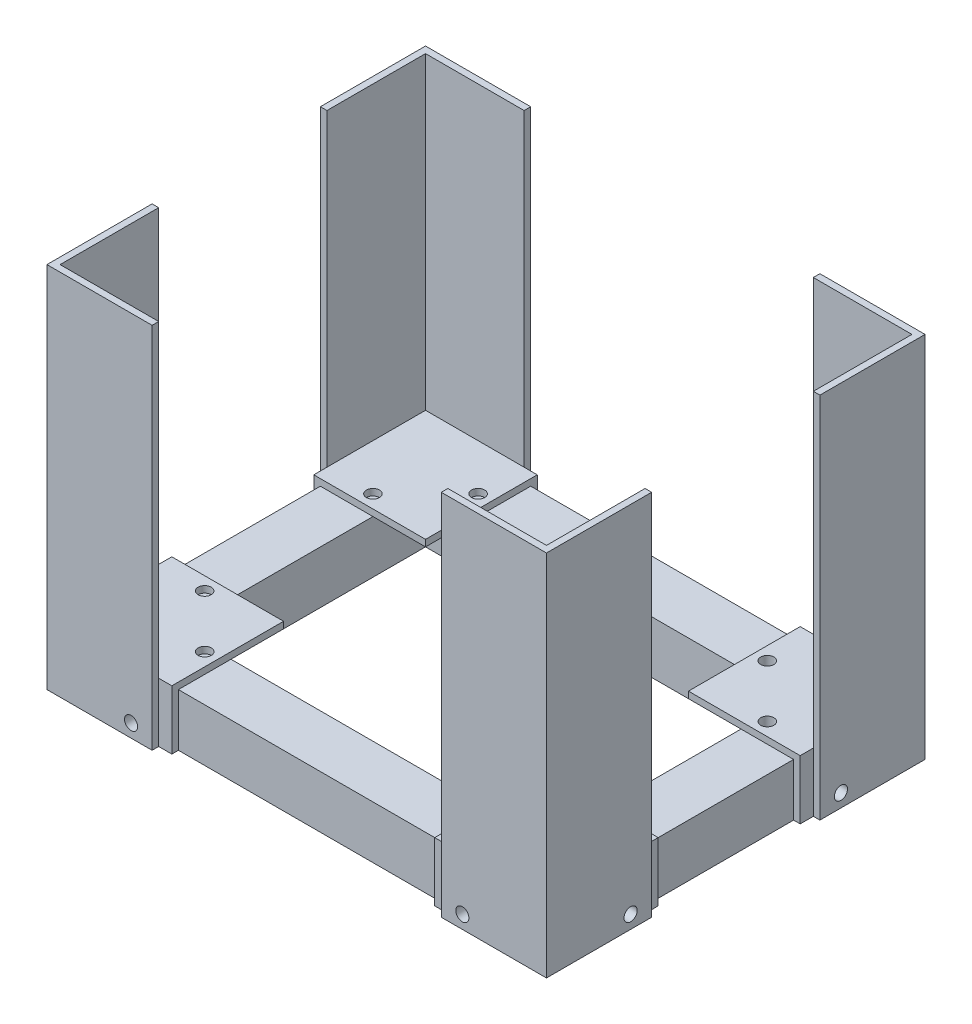
from build123d import *
from build123d.topology import SkipClean

# Parameters (mm, degrees)
SKETCH2_W             = 25.4
SKETCH2_H             = 119.38
BOSS_EXTRUDE1_DEPTH   = 25.4
SKETCH8_W             = 50.8
SKETCH8_H             = 3.175
BOSS_EXTRUDE9_DEPTH   = 25.4
SKETCH11_W            = 53.975
SKETCH11_H            = 53.975
BOSS_EXTRUDE12_DEPTH  = 3.175
CHAMFER3_SIZE         = 5.08
SKETCH10_W            = 3.175
SKETCH10_H            = 47.625
BOSS_EXTRUDE11_DEPTH  = 177.8
SKETCH13_R            = 3.175
CUT_EXTRUDE3_DEPTH    = 31.75
SKETCH14_R            = 3.175
CUT_EXTRUDE4_DEPTH    = 28.575
SKETCH16_R            = 3.175
CUT_EXTRUDE5_DEPTH    = 31.75
MIRROR71_START        = -1
MIRROR71_OUTLINE_R    = 3.175
MIRROR71_DEPTH        = 26.4
MIRROR71_2_DEPTH      = 177.8
MIRROR71_START_2      = 25.4
MIRROR71_3_OUTLINE_R  = 3.175
MIRROR71_3_DEPTH      = 3.175
MIRROR71_START_3      = 9.525
MIRROR71_4_OUTLINE_R  = 3.175
MIRROR71_4_DEPTH      = 15.875
MIRROR71_5_OUTLINE_R  = 3.175
MIRROR71_5_DEPTH      = 3.1749999
MIRROR71_START_4      = 2.6969085
MIRROR71_6_OUTLINE_R  = 3.175
MIRROR71_6_DEPTH      = 17.145
MIRROR71_START_5      = -85.09
MIRROR71_7_OUTLINE_W  = 3.175
MIRROR71_7_OUTLINE_H  = 6.3500001
MIRROR71_7_OUTLINE_R  = 3.175
MIRROR71_7_DEPTH      = 25.4
MIRROR71_START_6      = 59.69
MIRROR71_8_DEPTH      = 28.575
MIRROR71_START_7      = -88.265
MIRROR71_9_DEPTH      = 3.175
MIRROR71_START_8      = 85.09
MIRROR71_10_DEPTH     = 3.175
MIRROR71_START_9      = -91.896565
MIRROR71_11_OUTLINE_W = 6.3500001
MIRROR71_11_OUTLINE_H = 25.4
MIRROR71_11_DEPTH     = 155.396565
MIRROR71_START_10     = 88.9
MIRROR71_12_DEPTH     = 28.575
MIRROR71_START_11     = -114.3
MIRROR71_13_OUTLINE_R = 3.175
MIRROR71_13_DEPTH     = 25.4
MIRROR71_START_12     = 114.3
MIRROR71_14_DEPTH     = 3.175
MIRROR71_START_13     = -92
MIRROR71_15_OUTLINE_R = 3.175
MIRROR71_15_DEPTH     = 184
MIRROR71_16_OUTLINE_R = 3.175
MIRROR71_16_DEPTH     = 33.1


with BuildPart() as part:
    # Sketch2 → Boss-Extrude1 (new body)
    with BuildSketch(Plane(origin=(0, 0, 0), x_dir=(1, 0, 0), z_dir=(0, 1, 0))):
        Polygon((114.3, -59.69), (88.9, -59.69), (-88.9, -59.69), (-114.3, -59.69), (-114.3, -85.09), (114.3, -85.09), align=None)
        with Locations((101.6, 0)):
            Rectangle(SKETCH2_W, SKETCH2_H)
        Polygon((-88.9, 59.69), (88.9, 59.69), (114.3, 59.69), (114.3, 85.09), (-114.3, 85.09), (-114.3, 59.69), align=None)
        with Locations((-101.6, 0)):
            Rectangle(SKETCH2_W, SKETCH2_H)
    boss_extrude1 = extrude(amount=BOSS_EXTRUDE1_DEPTH)

    # Sketch8 → Boss-Extrude9 (add)
    with BuildSketch(Plane(origin=(0, 25.4, 0), x_dir=(1, 0, 0), z_dir=(0, 1, 0))):
        with Locations((-88.9, -86.6775)):
            Rectangle(SKETCH8_W, SKETCH8_H)
        Polygon((-114.3, -88.265), (-114.3, -85.09), (-114.3, -34.29), (-117.475, -34.29), (-117.475, -88.265), align=None)
    boss_extrude9 = extrude(amount=-BOSS_EXTRUDE9_DEPTH)

    # Sketch11 → Boss-Extrude12 (add)
    with BuildSketch(Plane(origin=(0, 25.4, 0), x_dir=(1, 0, 0), z_dir=(0, 1, 0))):
        with Locations((-90.4875, -61.2775)):
            Rectangle(SKETCH11_W, SKETCH11_H)
    boss_extrude12 = extrude(amount=BOSS_EXTRUDE12_DEPTH)

    # Chamfer3
    chamfer3_edges = [part.edges().sort_by_distance(p)[0] for p in [
        (-117.475, 14.2875, 88.265),
    ]]
    chamfer(chamfer3_edges, length=CHAMFER3_SIZE)

    # Sketch10 → Boss-Extrude11 (add)
    with BuildSketch(Plane(origin=(0, 0, 0), x_dir=(-1, 0, 0), z_dir=(0, -1, 0))):
        with Locations((119.0625, -64.4525)):
            Rectangle(SKETCH10_W, SKETCH10_H)
        Polygon((120.65, -88.265), (117.475, -88.265), (69.85, -88.265), (69.85, -91.44), (120.65, -91.44), align=None)
    boss_extrude11 = extrude(amount=-BOSS_EXTRUDE11_DEPTH)

    # Sketch13 → Cut-Extrude3 (cut)
    with BuildSketch(Plane.XY.offset(91.44)):
        with Locations((-80.01, 6.35)):
            Circle(SKETCH13_R)
    cut_extrude3 = extrude(amount=-CUT_EXTRUDE3_DEPTH, mode=Mode.SUBTRACT)

    # Sketch14 → Cut-Extrude4 (cut)
    with BuildSketch(Plane(origin=(0, 28.575, 0), x_dir=(1, 0, 0), z_dir=(0, 1, 0))):
        with Locations(Location((-69.85, -66.04, 0), (0, 0, 270))):
            Circle(SKETCH14_R)
        with Locations(Location((-95.25, -40.64, 0), (0, 0, 270))):
            Circle(SKETCH14_R)
    cut_extrude4 = extrude(amount=-CUT_EXTRUDE4_DEPTH, mode=Mode.SUBTRACT)

    # Sketch16 → Cut-Extrude5 (cut)
    with BuildSketch(Plane.ZY.offset(120.65)):
        with Locations((50.8, 6.35)):
            Circle(SKETCH16_R)
    cut_extrude5 = extrude(amount=-CUT_EXTRUDE5_DEPTH, mode=Mode.SUBTRACT)

    # Mirror70: Boss-Extrude1, Boss-Extrude9, Boss-Extrude12, Boss-Extrude11, Cut-Extrude3, Cut-Extrude4, Cut-Extrude5 across plane
    add(boss_extrude1.mirror(Plane.XY))
    add(boss_extrude9.mirror(Plane.XY))
    add(boss_extrude12.mirror(Plane.XY))
    add(boss_extrude11.mirror(Plane.XY))
    add(cut_extrude3.mirror(Plane.XY), mode=Mode.SUBTRACT)
    add(cut_extrude4.mirror(Plane.XY), mode=Mode.SUBTRACT)
    add(cut_extrude5.mirror(Plane.XY), mode=Mode.SUBTRACT)

    # Mirror71: read off the stored shape, not the designer's step
    # Mirror71 outline → Mirror71 (cut)
    with BuildSketch(Plane(origin=(0, 0, 0), x_dir=(1, 0, 0), z_dir=(0, 1, 0)).offset(MIRROR71_START)):
        with Locations((69.85, 66.04)):
            Circle(MIRROR71_OUTLINE_R)
        with Locations((95.25, 40.64)):
            Circle(MIRROR71_OUTLINE_R)
        with Locations((69.85, -66.04)):
            Circle(MIRROR71_OUTLINE_R)
        with Locations((95.25, -40.64)):
            Circle(MIRROR71_OUTLINE_R)
    extrude(amount=MIRROR71_DEPTH, mode=Mode.SUBTRACT)



with BuildPart() as body_2:
    # Mirror71 2 outline → Mirror71 2 (new body)
    with BuildSketch(Plane(origin=(0, 0, 0), x_dir=(1, 0, 0), z_dir=(0, 1, 0))):
        Polygon((117.475, -88.265), (69.85, -88.265), (69.85, -91.44), (120.65, -91.44), (120.65, -40.64), (117.475, -40.64), align=None)
        Polygon((117.475, 88.265), (117.475, 40.64), (120.65, 40.64), (120.65, 91.44), (69.85, 91.44), (69.85, 88.265), align=None)
    extrude(amount=MIRROR71_2_DEPTH)


with BuildPart() as part_1:
    add(part.part)

    add(body_2.part)  # Mirror71 3 merges body 2
    # Mirror71 3 outline → Mirror71 3 (add)
    # profile 1 of 2: a face of its own
    with BuildSketch(Plane(origin=(0, 0, 0), x_dir=(1, 0, 0), z_dir=(0, 1, 0)).offset(MIRROR71_START_2)):
        Polygon((63.5, -88.265), (117.475, -88.265), (117.475, -34.29), (88.9, -34.29), (63.5, -34.29), align=None)
        with Locations((95.25, -40.64)):
            Circle(MIRROR71_3_OUTLINE_R, mode=Mode.SUBTRACT)
        with Locations((69.85, -66.04)):
            Circle(MIRROR71_3_OUTLINE_R, mode=Mode.SUBTRACT)
    # profile 2 of 2: a face of its own
    with BuildSketch(Plane(origin=(0, 0, 0), x_dir=(1, 0, 0), z_dir=(0, 1, 0)).offset(MIRROR71_START_2)):
        Polygon((63.5, 34.29), (88.9, 34.29), (117.475, 34.29), (117.475, 88.265), (63.5, 88.265), align=None)
        with Locations((95.25, 40.64)):
            Circle(MIRROR71_3_OUTLINE_R, mode=Mode.SUBTRACT)
        with Locations((69.85, 66.04)):
            Circle(MIRROR71_3_OUTLINE_R, mode=Mode.SUBTRACT)
    extrude(amount=MIRROR71_3_DEPTH)

    # Mirror71 4 outline → Mirror71 4 (add)
    with BuildSketch(Plane(origin=(0, 0, 0), x_dir=(1, 0, 0), z_dir=(0, 1, 0)).offset(MIRROR71_START_3)):
        Polygon((63.5, -88.265), (117.475, -88.265), (117.475, -34.29), (114.3, -34.29), (114.3, -85.09), (63.5, -85.09), align=None)
        Polygon((114.3, 85.09), (114.3, 34.29), (117.475, 34.29), (117.475, 88.265), (63.5, 88.265), (63.5, 85.09), align=None)
        with Locations((-69.85, 66.04)):
            Circle(MIRROR71_4_OUTLINE_R)
        with Locations((-95.25, 40.64)):
            Circle(MIRROR71_4_OUTLINE_R)
    extrude(amount=MIRROR71_4_DEPTH)

    # Mirror71 5 outline → Mirror71 5 (add)
    with BuildSketch(Plane(origin=(0, 0, 0), x_dir=(1, 0, 0), z_dir=(0, 1, 0))):
        Polygon((63.5, -88.265), (117.475, -88.265), (117.475, -34.29), (114.3, -34.29), (114.3, -85.09), (63.5, -85.09), align=None)
        Polygon((114.3, 85.09), (114.3, 34.29), (117.475, 34.29), (117.475, 88.265), (63.5, 88.265), (63.5, 85.09), align=None)
        with Locations((-69.85, 66.04)):
            Circle(MIRROR71_5_OUTLINE_R)
        with Locations((-95.25, 40.64)):
            Circle(MIRROR71_5_OUTLINE_R)
    extrude(amount=MIRROR71_5_DEPTH)

    # Mirror71 6 outline → Mirror71 6 (add)
    with BuildSketch(Plane(origin=(0, 0, 0), x_dir=(1, 0, 0), z_dir=(0, 1, 0)).offset(MIRROR71_START_4)):
        with Locations((-69.85, 66.04)):
            Circle(MIRROR71_6_OUTLINE_R)
        with Locations((-95.25, 40.64)):
            Circle(MIRROR71_6_OUTLINE_R)
    extrude(amount=MIRROR71_6_DEPTH)

    # Mirror71 7 outline → Mirror71 7 (add)
    with BuildSketch(Plane.XY.offset(MIRROR71_START_5)):
        with Locations((115.8875, 6.34999995)):
            Rectangle(MIRROR71_7_OUTLINE_W, MIRROR71_7_OUTLINE_H)
        with Locations((-80.01, 6.35)):
            Circle(MIRROR71_7_OUTLINE_R)
    extrude(amount=MIRROR71_7_DEPTH)

    # Mirror71 8 outline → Mirror71 8 (add)
    with BuildSketch(Plane.XY.offset(MIRROR71_START_6)):
        with BuildLine():
            ThreePointArc((80.01, 9.525), (83.185, 6.35), (80.01, 3.175))
            Line((80.01, 3.175), (117.475, 3.1749999))
            Line((117.475, 3.1749999), (117.475, 9.525))
            Line((117.475, 9.525), (80.01, 9.525))
        make_face()
    extrude(amount=MIRROR71_8_DEPTH)

    # Mirror71 9 outline → Mirror71 9 (add)
    with BuildSketch(Plane.XY.offset(MIRROR71_START_7)):
        with BuildLine():
            ThreePointArc((80.01, 9.525), (83.185, 6.35), (80.01, 3.175))
            Line((80.01, 3.175), (117.475, 3.1749999))
            Line((117.475, 3.1749999), (117.475, 9.525))
            Line((117.475, 9.525), (80.01, 9.525))
        make_face()
        with BuildLine():
            ThreePointArc((80.01, 3.175), (76.835, 6.35), (80.01, 9.525))
            Line((80.01, 9.525), (63.5, 9.525))
            Line((63.5, 9.525), (63.5, 3.1749999))
            Line((63.5, 3.1749999), (80.01, 3.175))
        make_face()
    extrude(amount=MIRROR71_9_DEPTH)

    # Mirror71 10 outline → Mirror71 10 (add)
    with BuildSketch(Plane.XY.offset(MIRROR71_START_8)):
        with BuildLine():
            ThreePointArc((80.01, 3.175), (76.835, 6.35), (80.01, 9.525))
            Line((80.01, 9.525), (63.5, 9.525))
            Line((63.5, 9.525), (63.5, 3.1749999))
            Line((63.5, 3.1749999), (80.01, 3.175))
        make_face()
    extrude(amount=MIRROR71_10_DEPTH)

    # Mirror71 11 outline → Mirror71 11 (add)
    with BuildSketch(Plane.YZ.offset(MIRROR71_START_9)):
        with Locations((6.34999995, -72.39)):
            Rectangle(MIRROR71_11_OUTLINE_W, MIRROR71_11_OUTLINE_H)
    extrude(amount=MIRROR71_11_DEPTH)

    # Mirror71 12 outline → Mirror71 12 (add)
    with BuildSketch(Plane.YZ.offset(MIRROR71_START_10)):
        with BuildLine():
            ThreePointArc((9.525, -50.8), (6.35, -53.975), (3.175, -50.8))
            Line((3.175, -50.8), (3.1749999, -88.265))
            Line((3.1749999, -88.265), (9.525, -88.265))
            Line((9.525, -88.265), (9.525, -50.8))
        make_face()
        with BuildLine():
            ThreePointArc((3.175, 50.8), (6.35, 53.975), (9.525, 50.8))
            Line((9.525, 50.8), (9.525, 88.265))
            Line((9.525, 88.265), (3.1749999, 88.265))
            Line((3.1749999, 88.265), (3.175, 50.8))
        make_face()
    extrude(amount=MIRROR71_12_DEPTH)

    # Mirror71 13 outline → Mirror71 13 (add)
    with BuildSketch(Plane.YZ.offset(MIRROR71_START_11)):
        with Locations((6.35, -50.8)):
            Circle(MIRROR71_13_OUTLINE_R)
    extrude(amount=MIRROR71_13_DEPTH)

    # Mirror71 14 outline → Mirror71 14 (add)
    with BuildSketch(Plane.YZ.offset(MIRROR71_START_12)):
        with BuildLine():
            ThreePointArc((3.175, -50.8), (6.35, -47.625), (9.525, -50.8))
            Line((9.525, -50.8), (9.525, -34.29))
            Line((9.525, -34.29), (3.1749999, -34.29))
            Line((3.1749999, -34.29), (3.175, -50.8))
        make_face()
        with BuildLine():
            Line((9.525, 34.29), (9.525, 50.8))
            ThreePointArc((9.525, 50.8), (6.35, 47.625), (3.175, 50.8))
            Line((3.175, 50.8), (3.1749999, 34.29))
            Line((3.1749999, 34.29), (9.525, 34.29))
        make_face()
    extrude(amount=MIRROR71_14_DEPTH)

    # Mirror71 15 outline → Mirror71 15 (cut)
    with SkipClean():  # the faces are left unmerged after this step: merging them gives an invalid solid
        with BuildSketch(Plane.XY.offset(MIRROR71_START_13)):
            with Locations((80.01, 6.35)):
                Circle(MIRROR71_15_OUTLINE_R)
        extrude(amount=MIRROR71_15_DEPTH, mode=Mode.SUBTRACT)

    # Mirror71 16 outline → Mirror71 16 (cut)
    with SkipClean():  # the faces are left unmerged after this step: merging them gives an invalid solid
        with BuildSketch(Plane.YZ.offset(MIRROR71_START_10)):
            with Locations((6.35, -50.8)):
                Circle(MIRROR71_16_OUTLINE_R)
            with Locations((6.35, 50.8)):
                Circle(MIRROR71_16_OUTLINE_R)
        extrude(amount=MIRROR71_16_DEPTH, mode=Mode.SUBTRACT)


solid = part_1.part
